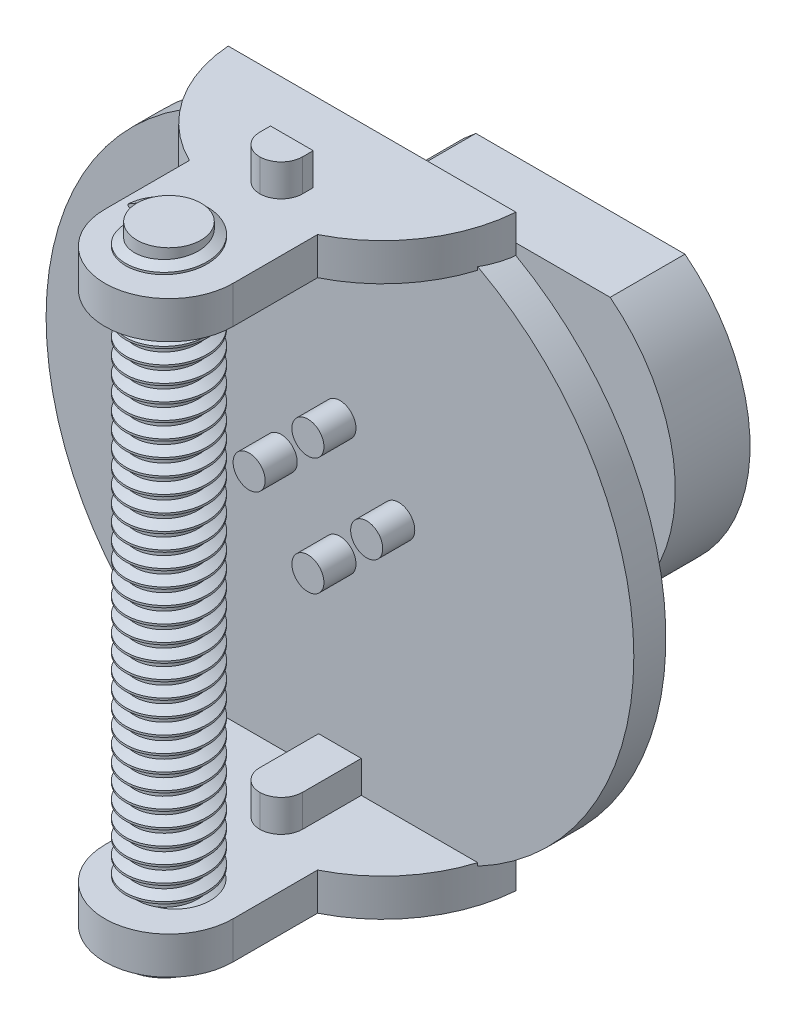
from build123d import *
from build123d.topology import SkipClean

# Parameters (mm, degrees)
BOSS_EXTRUDE1_DEPTH      = 7
SKETCH3_R                = 27.5
BOSS_EXTRUDE2_DEPTH      = 3
BOSS_EXTRUDE3_DEPTH      = 3
BOSS_EXTRUDE3_DEPTH_BACK = 11
SKETCH4_R                = 1.5
FILLET1_R                = 1
BOSS_EXTRUDE4_DEPTH      = 2
FILLET3_R                = 2
FILLET4_RADIUS           = 2
FILLET4_LENGTH           = 3
FILLET5_RADIUS           = 2
FILLET5_LENGTH           = 3
BOSS_EXTRUDE7_START      = -1e-05
SKETCH6_R                = 3
BOSS_EXTRUDE7_DEPTH      = 3.50001
THREAD1_PITCH            = 1.5


with BuildPart() as part:
    # Sketch1 → Boss-Extrude1 (new body)
    with BuildSketch(Plane.XY):
        with BuildLine():
            Line((-9.785, 12.507124969), (9.785, 12.507124969))
            ThreePointArc((9.785, 12.507124969), (0, -15.88), (-9.785, 12.507124969))
        make_face()
    extrude(amount=BOSS_EXTRUDE1_DEPTH)

    # Sketch2 → Revolve1 (revolve)
    with BuildSketch(Plane(origin=(0, 0, 0), x_dir=(0, 0, -1), z_dir=(1, 0, 0)), mode=Mode.PRIVATE) as revolve1_sk:
        Polygon((0, 0), (0, 3), (-10, 3), (-10, 1.5), (-12.5, 1.5), (-12.5, 4.4), (-19.5, 4.4), (-19.5, 0), align=None)
    revolve(revolve1_sk.sketch.rotate(Axis((0, 0, 0), (0, 0, 1)), 90), axis=Axis((0, 0, 0), (0, 0, 1)))

    # Sketch3 → Boss-Extrude2 (add)
    with BuildSketch(Plane.XY.offset(19.5)):
        Circle(SKETCH3_R)
    extrude(amount=BOSS_EXTRUDE2_DEPTH)

    # Sketch4 → Boss-Extrude3 (add, two sides: drawn at the far end of the back side and taken through both)
    with BuildSketch(Plane.XY.offset(22.5).offset(-BOSS_EXTRUDE3_DEPTH_BACK)):
        with Locations((0, 5.5)):
            Circle(SKETCH4_R)
        with Locations((5.5, 0)):
            Circle(SKETCH4_R)
        with Locations((0, -5.5)):
            Circle(SKETCH4_R)
        with Locations((-5.5, 0)):
            Circle(SKETCH4_R)
    extrude(amount=BOSS_EXTRUDE3_DEPTH + BOSS_EXTRUDE3_DEPTH_BACK)

    # Fillet1
    fillet1_edges = [part.edges().sort_by_distance(p)[0] for p in [
        (-1.5, 5.5, 11.5),
        (4, 0, 11.5),
        (-1.5, -5.5, 11.5),
        (-7, 0, 11.5),
    ]]
    fillet(fillet1_edges, radius=FILLET1_R - 0.0001)  # a hair under: the kernel refuses the full size

    # Sketch5 → Boss-Extrude4 (add, symmetric)
    with BuildSketch(Plane(origin=(0, 0, 0), x_dir=(0, 0, -1), z_dir=(1, 0, 0))):
        Polygon((-30, 30.5), (-30, 21), (-16.5, 21), (-16.5, 24), (-27, 24), (-27, 30.5), align=None)
        Polygon((-27, -30.5), (-30, -30.5), (-30, -21), (-16.5, -21), (-16.5, -24), (-27, -24), align=None)
    extrude(amount=BOSS_EXTRUDE4_DEPTH, both=True)

    # Fillet3
    fillet3_edges = [part.edges().sort_by_distance(p)[0] for p in [
        (2, -25.75, 30),
        (-2, -25.75, 30),
        (2, 25.75, 30),
        (-2, 25.75, 30),
    ]]
    fillet(fillet3_edges, radius=FILLET3_R - 0.0001)  # a hair under: the kernel refuses the full size

    # Fillet4: full round fillet: the end face becomes a half cylinder, R = half its width
    fillet4_face = Plane((0, 22.5, 16.5), x_dir=(0, -1, 0), z_dir=(0, 0, -1))  # on the end face: x along it, z out of the body
    fillet4_slab = fillet4_face.offset(-FILLET4_RADIUS / 2) * Box(FILLET4_LENGTH, 2 * FILLET4_RADIUS, FILLET4_RADIUS, mode=Mode.PRIVATE)  # the body's end, R deep
    fillet4_round = Plane((0, 22.5, 18.5), x_dir=(0, 0, -1), z_dir=(0, -1, 0)) * Cylinder(FILLET4_RADIUS, FILLET4_LENGTH, mode=Mode.PRIVATE)  # its axis R under the face
    add(fillet4_slab - fillet4_round, mode=Mode.SUBTRACT)

    # Fillet5: full round fillet: the end face becomes a half cylinder, R = half its width
    fillet5_face = Plane((0, -22.5, 16.5), x_dir=(0, -1, 0), z_dir=(0, 0, -1))  # on the end face: x along it, z out of the body
    fillet5_slab = fillet5_face.offset(-FILLET5_RADIUS / 2) * Box(FILLET5_LENGTH, 2 * FILLET5_RADIUS, FILLET5_RADIUS, mode=Mode.PRIVATE)  # the body's end, R deep
    fillet5_round = Plane((0, -22.5, 18.5), x_dir=(0, 0, -1), z_dir=(0, -1, 0)) * Cylinder(FILLET5_RADIUS, FILLET5_LENGTH, mode=Mode.PRIVATE)  # its axis R under the face
    add(fillet5_slab - fillet5_round, mode=Mode.SUBTRACT)

    # Sketch6 → Boss-Extrude7 (add)
    with BuildSketch(Plane(origin=(0, 24, 0), x_dir=(1, 0, 0), z_dir=(0, 1, 0)).offset(BOSS_EXTRUDE7_START)):
        with BuildLine():
            Line((13.462912018, -19.5), (-13.462912018, -19.5))
            ThreePointArc((-13.462912018, -19.5), (-11.2012072, -26.035446719), (-6, -30.593386622))
            Line((-6, -30.593386622), (-6, -38.5))
            ThreePointArc((-6, -38.5), (0, -44.5), (6, -38.5))
            Line((6, -38.5), (6, -30.593386622))
            ThreePointArc((6, -30.593386622), (11.2012072, -26.035446719), (13.462912018, -19.5))
        make_face()
        with Locations(Location((0, -38.5, 0), (0, 0, 90))):
            Circle(SKETCH6_R, mode=Mode.SUBTRACT)
    boss_extrude7 = extrude(amount=BOSS_EXTRUDE7_DEPTH)

    # Mirror1: Boss-Extrude7 across plane
    add(boss_extrude7.mirror(Plane.ZX))

    # Sketch8 → Revolve2 (revolve)
    with BuildSketch(Plane(origin=(0, 0, 0), x_dir=(0, 0, -1), z_dir=(1, 0, 0))):
        Polygon((-38.5, -27.5), (-38.5, 29.5), (-35.5, 29.5), (-35.5, -29.5), (-38.5, -29.5), align=None)
    revolve(axis=Axis((0, -27.5, 38.5), (0, 1, 0)))

    # Thread1: arcs per turn and ends read off the stored shape
    # Thread1: the profile of Thread Profile1 profile screwed along a right-hand helix through 39.333333 turns, 8 arcs to a turn; built about Z, then put on its axis
    with SkipClean():  # the faces are left unmerged after this step: merging them gives an invalid solid
        thread1_z = Axis((0, 0, 0), (0, 0, 1))
        thread1_corners = [(2.9997, 0, -0.000173205), (3.811898812, 0, 0.468749998), (3.811898812, 0, 0.656249998), (2.9997, 0, 1.125173201)]
        with BuildLine(mode=Mode.PRIVATE) as thread1_profile:
            Line(thread1_corners[0], thread1_corners[1])
            Line(thread1_corners[1], thread1_corners[2])
            Line(thread1_corners[2], thread1_corners[3])
            Line(thread1_corners[3], thread1_corners[0])
        thread1_cap = Face(thread1_profile.wire())
        thread1_turn_angles = [0, 22.5, 45, 67.5, 90, 112.5, 135, 157.5, 180, 202.5, 225, 247.5, 270, 292.5, 315, 337.5, 360]
        thread1_turn_weights = [1, 0.9238795325112867, 1, 0.9238795325112867, 1, 0.9238795325112867, 1, 0.9238795325112867, 1, 0.9238795325112867, 1, 0.9238795325112867, 1, 0.9238795325112867, 1, 0.9238795325112867, 1]
        thread1_turn_rails = [Edge.make_bspline([Vector(p[0], p[1], 0).rotate(thread1_z, thread1_turn_angles[k]) / thread1_turn_weights[k] + Vector(0, 0, p[2] + THREAD1_PITCH * thread1_turn_angles[k] / 360) for k in range(17)], [0, 0, 0, 1, 1, 2, 2, 3, 3, 4, 4, 5, 5, 6, 6, 7, 7, 8, 8, 8], 2, thread1_turn_weights) for p in thread1_corners]
        thread1_turn_sides = [Face.make_surface_from_curves(thread1_turn_rails[p[0]], thread1_turn_rails[p[1]]) for p in [(0, 1), (1, 2), (2, 3), (3, 0)]]
        thread1_last_angles = [14040, 14062.5, 14085, 14107.5, 14130, 14145, 14160]
        thread1_last_weights = [1, 0.9238795325112867, 1, 0.9238795325112867, 1, 0.9659258262890724, 1]
        thread1_last_rails = [Edge.make_bspline([Vector(p[0], p[1], 0).rotate(thread1_z, thread1_last_angles[k]) / thread1_last_weights[k] + Vector(0, 0, p[2] + THREAD1_PITCH * thread1_last_angles[k] / 360) for k in range(7)], [0, 0, 0, 1, 1, 2, 2, 3, 3, 3], 2, thread1_last_weights) for p in thread1_corners]
        thread1_last_sides = [Face.make_surface_from_curves(thread1_last_rails[p[0]], thread1_last_rails[p[1]]) for p in [(0, 1), (1, 2), (2, 3), (3, 0)]]
        thread1 = Plane(origin=(0, 29.5, 38.5), x_dir=(-1, 0, 0), z_dir=(0, -1, 0)) * Solid(Shell([*[p.moved(Location((0, 0, THREAD1_PITCH * i))) for i in range(39) for p in thread1_turn_sides], *thread1_last_sides, thread1_cap, thread1_cap.rotate(thread1_z, 14160).moved(Location((0, 0, THREAD1_PITCH * 14160 / 360)))]))
        add(thread1)


solid = part.part
